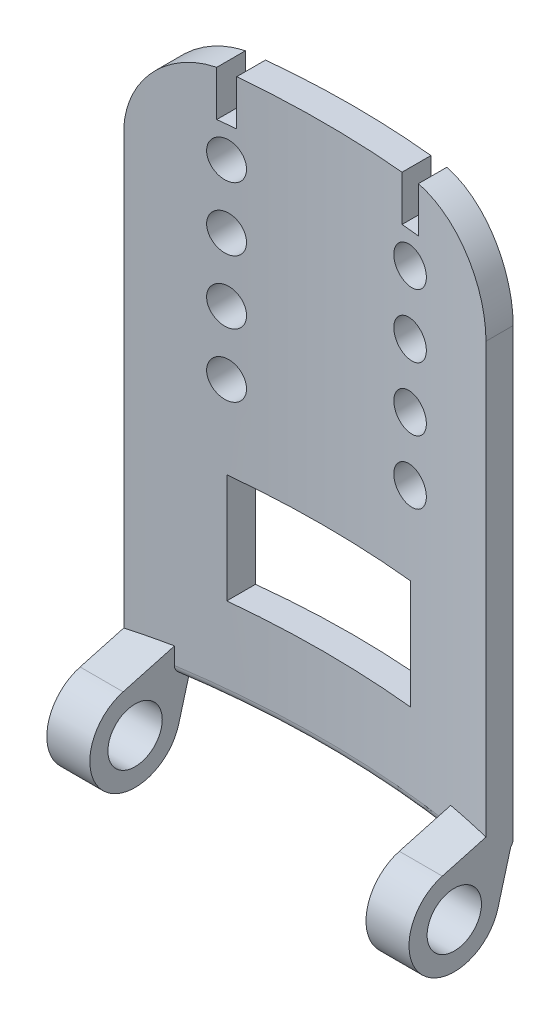
from build123d import *

# Parameters (mm, degrees)
EXTRUDE_2_DEPTH          = 60
SKETCH_2_R               = 3
EXTRUDE_3_DEPTH          = 4.75
CUT_EXTRUDE_1_DEPTH      = 64.814183376
CUT_EXTRUDE_1_DEPTH_BACK = 64.814183376
SKETCH_3_R               = 2
SKETCH_3_W               = 2
SKETCH_3_H               = 5
SKETCH_3_W_2             = 20.264839538
SKETCH_3_H_2             = 12.066259255
FILLET_START             = -6
FILLET_1_DEPTH           = 14.5
FILLET_4_R               = 1


with BuildPart() as part:
    # 草图1 → 凸台-拉伸2 (new body)
    with BuildSketch(Plane(origin=(0, 0, 0), x_dir=(1, 0, 0), z_dir=(0, 1, 0))):
        with BuildLine():
            Line((-20, 0), (-20, 3))
            ThreePointArc((-20, 3), (0, 5.250356126), (20, 3))
            Line((20, 3), (20, 0))
            ThreePointArc((20, 0), (0, 2.020410289), (-20, 0))
        make_face()
    extrude(amount=EXTRUDE_2_DEPTH)

    # 草图2 → 凸台-拉伸3 (add)
    with BuildSketch(Plane(origin=(20, 0, 0), x_dir=(0, 0, -1), z_dir=(1, 0, 0))):
        with BuildLine():
            Line((1.10338457, 2.94661543), (-4.822051432, 1.322051432))
            ThreePointArc((-4.822051432, 1.322051432), (-7.035533906, -7.035533906), (1.322051432, -4.822051432))
            Line((1.322051432, -4.822051432), (2.94661543, 1.10338457))
            ThreePointArc((2.94661543, 1.10338457), (2.560660172, 2.560660172), (1.10338457, 2.94661543))
        make_face()
        with Locations((-3.5, -3.5)):
            Circle(SKETCH_2_R, mode=Mode.SUBTRACT)
    extrude_3 = extrude(amount=-EXTRUDE_3_DEPTH)

    # 镜向1: 凸台-拉伸3 across plane
    add(extrude_3.mirror(Plane(origin=(0, 0, 0), x_dir=(0, 0, 1), z_dir=(1, 0, 0))))

    # 草图3 → 切除-拉伸1 (cut, two sides: drawn at the far end of the back side and taken through both)
    with BuildSketch(Plane.XY.offset(-CUT_EXTRUDE_1_DEPTH_BACK)):
        with Locations((-10.132419769, 30.593876153)):
            Circle(SKETCH_3_R)
        with Locations((10.132419769, 30.593876153)):
            Circle(SKETCH_3_R)
        with Locations((-10.132419769, 37.593876153)):
            Circle(SKETCH_3_R)
        with Locations((10.132419769, 37.593876153)):
            Circle(SKETCH_3_R)
        with Locations((-10.132419769, 44.593876153)):
            Circle(SKETCH_3_R)
        with Locations((10.132419769, 44.593876153)):
            Circle(SKETCH_3_R)
        with Locations((-10.132419769, 51.593876153)):
            Circle(SKETCH_3_R)
        with Locations((10.132419769, 51.593876153)):
            Circle(SKETCH_3_R)
        with Locations((-10.132419769, 57.5)):
            Rectangle(SKETCH_3_W, SKETCH_3_H)
        with Locations((10.132419769, 57.5)):
            Rectangle(SKETCH_3_W, SKETCH_3_H)
        with Locations((0, 15.444735322)):
            Rectangle(SKETCH_3_W_2, SKETCH_3_H_2)
    extrude(amount=CUT_EXTRUDE_1_DEPTH + CUT_EXTRUDE_1_DEPTH_BACK, mode=Mode.SUBTRACT)

    # 圆角1: read off the stored shape, not the designer's step
    # 圆角1 outline → 圆角1 (cut)
    with BuildSketch(Plane.XY.offset(FILLET_START)):
        with BuildLine():
            ThreePointArc((11.132419769, 60), (17.460703643, 56.722996741), (20, 50.064325616))
            Line((20, 50.064325616), (20, 60))
            Line((20, 60), (11.132419769, 60))
        make_face()
        with BuildLine():
            Line((-20, 60), (-20, 50.064325616))
            ThreePointArc((-20, 50.064325616), (-17.460703643, 56.722996741), (-11.132419769, 60))
            Line((-11.132419769, 60), (-20, 60))
        make_face()
    extrude(amount=FILLET_1_DEPTH, mode=Mode.SUBTRACT)

    # 圆角4
    fillet_4_edges = [part.edges().sort_by_distance(p)[0] for p in [
        (0, 0, -5.250356126),
        (0, 0, -2.020410289),
    ]]
    fillet(fillet_4_edges, radius=FILLET_4_R)


solid = part.part
